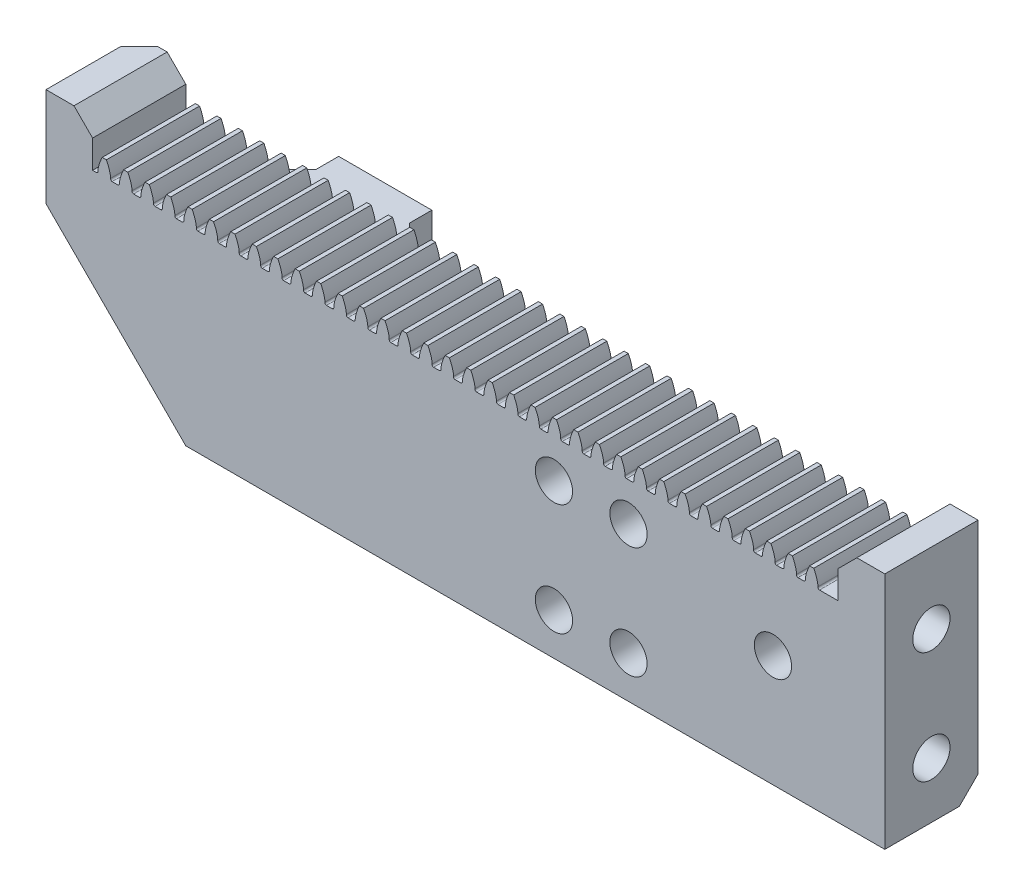
from build123d import *

# Parameters (mm, degrees)
SZKIC1_W                    = 23
SZKIC1_H                    = 17
SZKIC1_H_2                  = 1.6
DODANIE_WYCI_GNI_CIE1_DEPTH = 10
SZKIC2_R                    = 1.25
WYTNIJ_WYCI_GNI_CIE1_DEPTH  = 10
SZKIC3_R                    = 2
WYTNIJ_WYCI_GNI_CIE2_DEPTH  = 7
DODANIE_WYCI_GNI_CIE2_DEPTH = 10
SZYK_LINIOWY1_COUNT         = 36
SZYK_LINIOWY1_PITCH         = 2.3
SZKIC5_W                    = 90
SZKIC5_H                    = 10
DODANIE_WYCI_GNI_CIE3_DEPTH = 2
SZKIC7_W                    = 5
SZKIC7_H                    = 10
DODANIE_WYCI_GNI_CIE5_DEPTH = 5
SFAZOWANIE1_SIZE            = 2
SZKIC8_R                    = 2
WYTNIJ_WYCI_GNI_CIE3_DEPTH  = 8
SZKIC9_R                    = 1.5
WYTNIJ_WYCI_GNI_CIE4_DEPTH  = 5
SZKIC10_R                   = 2
WYTNIJ_WYCI_GNI_CIE5_DEPTH  = 8
SZKIC11_W                   = 10
SZKIC11_H                   = 4
DODANIE_WYCI_GNI_CIE6_DEPTH = 4.4
SZKIC12_W                   = 10
SZKIC12_H                   = 5.6
DODANIE_WYCI_GNI_CIE7_DEPTH = 2
SFAZOWANIE2_SIZE            = 4
SFAZOWANIE3_SIZE            = 1
SFAZOWANIE4_SIZE            = 15
SFAZOWANIE5_SIZE            = 2


with BuildPart() as part:
    # Szkic1 → Dodanie-wyciągnięcie1 (new body)
    with BuildSketch(Plane.XY):
        Rectangle(SZKIC1_W, SZKIC1_H)
        with Locations((0, 9.3)):
            Rectangle(SZKIC1_W, SZKIC1_H_2)
        Polygon((11.5, -8.5), (31.5, -8.5), (31.5, 10.1), (11.5, 10.1), (11.5, 8.5), align=None)
        Polygon((-11.5, 10.1), (-58.5, 10.1), (-58.5, -8.5), (-11.5, -8.5), (-11.5, 8.5), align=None)
    extrude(amount=DODANIE_WYCI_GNI_CIE1_DEPTH)

    # Szkic2 → Wytnij-wyciągnięcie1 (cut)
    with BuildSketch(Plane.XY.offset(10)):
        with Locations((-4, 6)):
            Circle(SZKIC2_R)
        with Locations((4, 6)):
            Circle(SZKIC2_R)
        with Locations((-4, -6)):
            Circle(SZKIC2_R)
        with Locations((4, -6)):
            Circle(SZKIC2_R)
    extrude(amount=-WYTNIJ_WYCI_GNI_CIE1_DEPTH, mode=Mode.SUBTRACT)

    # Szkic3 → Wytnij-wyciągnięcie2 (cut)
    with BuildSketch(Plane.XY.offset(10)):
        with Locations((-4, 6)):
            Circle(SZKIC3_R)
        with Locations((4, 6)):
            Circle(SZKIC3_R)
        with Locations((4, -6)):
            Circle(SZKIC3_R)
        with Locations((-4, -6)):
            Circle(SZKIC3_R)
    extrude(amount=-WYTNIJ_WYCI_GNI_CIE2_DEPTH, mode=Mode.SUBTRACT)

    # Szkic4 → Dodanie-wyciągnięcie2 (add)
    with BuildSketch(Plane.XY.offset(10)):
        with BuildLine():
            ThreePointArc((24.5, 10.1), (24.372943751, 10.163546485), (24.326913949, 10.297944042))
            Line((24.326913949, 10.297944042), (24.32854542, 10.325770314))
            add(Edge.make_bspline(
                [(24.32854542, 10.325770314), (24.328857247, 10.334102961), (24.329185769, 10.357487762), (24.327649978, 10.401726578), (24.322081988, 10.473795217), (24.310498187, 10.565330837), (24.290391379, 10.683083104), (24.260136791, 10.820872715), (24.220053355, 10.971065024), (24.169137494, 11.132866573), (24.111933501, 11.292665278), (24.04897128, 11.450372563), (23.982934355, 11.601323615), (23.930462181, 11.711995881), (23.8949251, 11.783608213), (23.877971017, 11.817070324)],
                knots=[0, 0, 0, 0, 0, 0.005376748, 0.015083688, 0.02853182, 0.046610139, 0.064854849, 0.092110525, 0.119476175, 0.146842495, 0.174208853, 0.201574955, 0.228941013, 0.253142236, 0.253142236, 0.253142236, 0.253142236, 0.253142236], degree=4))
            ThreePointArc((23.877971017, 11.817070324), (23.652458076, 11.818780314), (23.426950168, 11.816501365))
            add(Edge.make_bspline(
                [(23.426950168, 11.816501365), (23.410080563, 11.782996587), (23.374724271, 11.711294824), (23.322531488, 11.600490524), (23.256875619, 11.449373343), (23.194311489, 11.291507707), (23.137510847, 11.131565186), (23.087003369, 10.969635693), (23.047298992, 10.819342733), (23.01739214, 10.681477228), (22.997582482, 10.563674608), (22.98622966, 10.472110053), (22.980843515, 10.400027595), (22.979419342, 10.355785046), (22.979806863, 10.332401148), (22.980139712, 10.324069314)],
                knots=[0, 0, 0, 0, 0, 0.024201223, 0.051567281, 0.078933383, 0.106299741, 0.133666061, 0.161031712, 0.188287388, 0.206532097, 0.224610417, 0.238058549, 0.247765488, 0.253142236, 0.253142236, 0.253142236, 0.253142236, 0.253142236], degree=4))
            Line((22.980139712, 10.324069314), (22.981841383, 10.296247247))
            ThreePointArc((22.981841383, 10.296247247), (22.941668135, 10.168378983), (22.82639239, 10.1))
            Line((22.82639239, 10.1), (24.5, 10.1))
        make_face()
    dodanie_wyci_gni_cie2 = extrude(amount=-DODANIE_WYCI_GNI_CIE2_DEPTH)

    # Szyk liniowy1: Dodanie-wyciągnięcie2 ×36
    with Locations(*[(-i * SZYK_LINIOWY1_PITCH, 0, 0) for i in range(1, SZYK_LINIOWY1_COUNT)]):
        add(dodanie_wyci_gni_cie2)

    # Szkic5 → Dodanie-wyciągnięcie3 (add)
    with BuildSketch(Plane.XZ.offset(8.5)):
        with Locations((-13.5, 5)):
            Rectangle(SZKIC5_W, SZKIC5_H)
    extrude(amount=DODANIE_WYCI_GNI_CIE3_DEPTH)

    # Szkic7 → Dodanie-wyciągnięcie5 (add)
    with BuildSketch(Plane(origin=(0, 10.1, 0), x_dir=(1, 0, 0), z_dir=(0, 1, 0))):
        with Locations((-56, -5)):
            Rectangle(SZKIC7_W, SZKIC7_H)
        with Locations((29, -5)):
            Rectangle(SZKIC7_W, SZKIC7_H)
    extrude(amount=DODANIE_WYCI_GNI_CIE5_DEPTH)

    # Sfazowanie1
    sfazowanie1_edges = [part.edges().sort_by_distance(p)[0] for p in [
        (-53.5, 15.1, 5),
        (26.5, 15.1, 5),
    ]]
    chamfer(sfazowanie1_edges, length=SFAZOWANIE1_SIZE)

    # Szkic8 → Wytnij-wyciągnięcie3 (cut)
    with BuildSketch(Plane(origin=(31.5, 0, 0), x_dir=(0, 0, -1), z_dir=(1, 0, 0))):
        with Locations((-5, -4.5)):
            Circle(SZKIC8_R)
        with Locations((-5, 7.5)):
            Circle(SZKIC8_R)
    extrude(amount=-WYTNIJ_WYCI_GNI_CIE3_DEPTH, mode=Mode.SUBTRACT)

    # Szkic9 → Wytnij-wyciągnięcie4 (cut)
    with BuildSketch(Plane(origin=(23.5, 0, 0), x_dir=(0, 0, -1), z_dir=(1, 0, 0))):
        with Locations((-5, 7.5)):
            Circle(SZKIC9_R)
        with Locations((-5, -4.5)):
            Circle(SZKIC9_R)
    extrude(amount=-WYTNIJ_WYCI_GNI_CIE4_DEPTH, mode=Mode.SUBTRACT)

    # Szkic10 → Wytnij-wyciągnięcie5 (cut)
    with BuildSketch(Plane.XY.offset(10)):
        with Locations((19.5, 1.5)):
            Circle(SZKIC10_R)
    extrude(amount=-WYTNIJ_WYCI_GNI_CIE5_DEPTH, mode=Mode.SUBTRACT)

    # Szkic11 → Dodanie-wyciągnięcie6 (add)
    with BuildSketch(Plane(origin=(0, 0, 0), x_dir=(-1, 0, 0), z_dir=(0, 0, -1))):
        with Locations((38.5, 6.2)):
            Rectangle(SZKIC11_W, SZKIC11_H)
    extrude(amount=DODANIE_WYCI_GNI_CIE6_DEPTH)

    # Szkic12 → Dodanie-wyciągnięcie7 (add)
    with BuildSketch(Plane(origin=(0, 0, -4.4), x_dir=(-1, 0, 0), z_dir=(0, 0, -1))):
        with Locations((38.5, 5.4)):
            Rectangle(SZKIC12_W, SZKIC12_H)
    extrude(amount=DODANIE_WYCI_GNI_CIE7_DEPTH)

    # Sfazowanie2
    sfazowanie2_edges = [part.edges().sort_by_distance(p)[0] for p in [
        (-43.5, 6.2, 0),
        (-33.5, 6.2, 0),
    ]]
    chamfer(sfazowanie2_edges, length=SFAZOWANIE2_SIZE)

    # Sfazowanie3
    sfazowanie3_edges = [part.edges().sort_by_distance(p)[0] for p in [
        (-38.5, 8.2, 0),
        (-38.5, 4.2, 0),
        (-38.5, 2.6, -4.4),
        (-33.5, 2.6, -5.4),
        (-43.5, 2.6, -5.4),
        (-38.5, 2.6, -6.4),
    ]]
    chamfer(sfazowanie3_edges, length=SFAZOWANIE3_SIZE - 0.0001)  # a hair under: the kernel refuses the full size

    # Sfazowanie4
    sfazowanie4_edges = [part.edges().sort_by_distance(p)[0] for p in [
        (-58.5, -10.5, 5),
    ]]
    chamfer(sfazowanie4_edges, length=SFAZOWANIE4_SIZE)

    # Sfazowanie5
    sfazowanie5_edges = [part.edges().sort_by_distance(p)[0] for p in [
        (-6, -10.5, 0),
        (-51, -3, 0),
        (-58.5, 9.8, 0),
    ]]
    chamfer(sfazowanie5_edges, length=SFAZOWANIE5_SIZE)


solid = part.part
